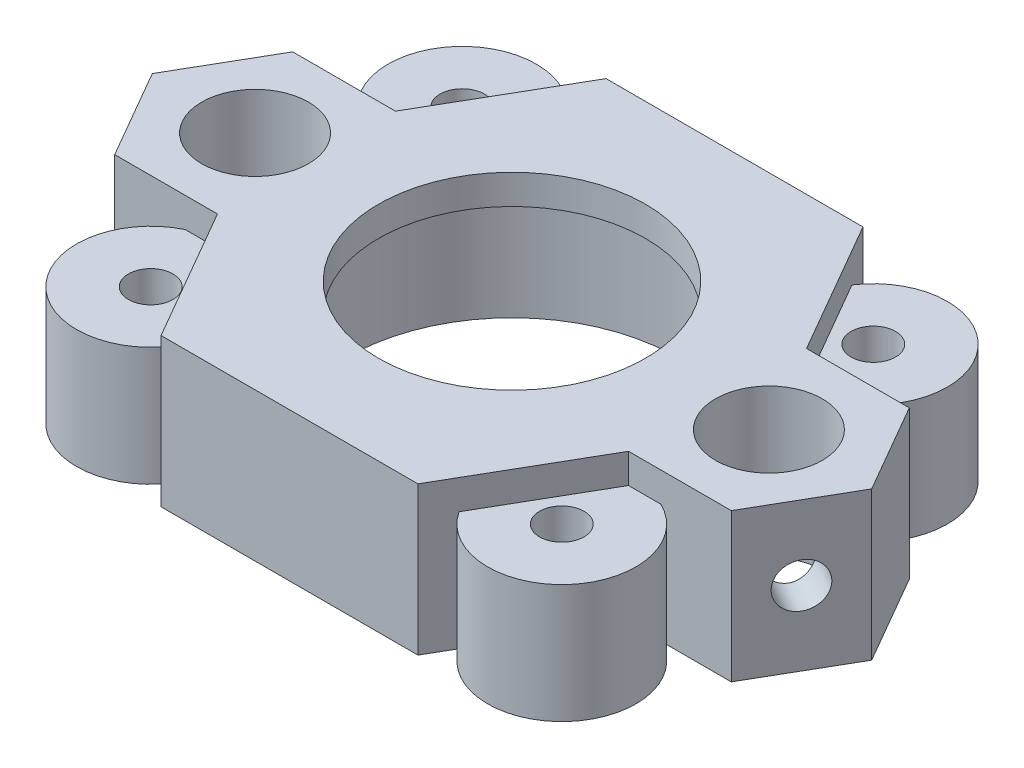
from build123d import *
from build123d.topology import SkipClean

# Parameters (mm, degrees)
SKETCH1_R                      = 1.5
SKETCH1_R_2                    = 3.6
BOSS_EXTRUDE1_DEPTH            = 8
SKETCH2_R                      = 9
SKETCH2_R_2                    = 3.6
BOSS_EXTRUDE2_DEPTH            = 2
CUT_EXTRUDE1_REACH             = 52.762
CUT_EXTRUDE1_END_RADIUS        = 3.6
SKETCH4_R                      = 1.5
CUT_EXTRUDE1_DIRECTION_2_DEPTH = 51.761698159
CUT_EXTRUDE2_REACH             = 52.762
CUT_EXTRUDE2_END_RADIUS        = 3.6
SKETCH5_R                      = 1.5


with BuildPart() as part:
    # Sketch1 → Boss-Extrude1 (new body)
    with BuildSketch(Plane(origin=(0, 0, 0), x_dir=(1, 0, 0), z_dir=(0, 1, 0))):
        with BuildLine():
            Line((9.675277915, 13.241927075), (8.660254038, 15))
            Line((8.660254038, 15), (-8.660254038, 15))
            Line((-8.660254038, 15), (-9.675277915, 13.241927075))
            ThreePointArc((-9.675277915, 13.241927075), (-17.613141308, 13.799536829), (-16.035855932, 6))
            Line((-16.035855932, 6), (-20.784609691, 6))
            Line((-20.784609691, 6), (-24.248711306, 0))
            Line((-24.248711306, 0), (-20.784609691, -6))
            Line((-20.784609691, -6), (-16.035855932, -6))
            ThreePointArc((-16.035855932, -6), (-17.613141308, -13.799536829), (-9.675277915, -13.241927075))
            Line((-9.675277915, -13.241927075), (-8.660254038, -15))
            Line((-8.660254038, -15), (8.660254038, -15))
            Line((8.660254038, -15), (9.675277915, -13.241927075))
            ThreePointArc((9.675277915, -13.241927075), (17.613141308, -13.799536829), (16.035855932, -6))
            Line((16.035855932, -6), (20.784609691, -6))
            Line((20.784609691, -6), (24.248711306, 0))
            Line((24.248711306, 0), (20.784609691, 6))
            Line((20.784609691, 6), (16.035855932, 6))
            ThreePointArc((16.035855932, 6), (17.613141308, 13.799536829), (9.675277915, 13.241927075))
        make_face()
        with Locations((-13.856406461, -10.5)):
            Circle(SKETCH1_R, mode=Mode.SUBTRACT)
        with Locations((13.856406461, -10.5)):
            Circle(SKETCH1_R, mode=Mode.SUBTRACT)
        with BuildLine():
            ThreePointArc((-13.720508076, 0), (-20.438199529, -1.8), (-15.520508076, 3.117691454))
            ThreePointArc((-15.520508076, 3.117691454), (-14.202816622, 1.8), (-13.720508076, 0))
        make_face(mode=Mode.SUBTRACT)
        with Locations((-13.856406461, 10.5)):
            Circle(SKETCH1_R, mode=Mode.SUBTRACT)
        with BuildLine():
            ThreePointArc((11.064000224, 1.163410523), (11.109739589, 0.582504296), (11.125, 0))
            ThreePointArc((11.125, 0), (-11.109739589, -0.582504296), (11.064000224, 1.163410523))
        make_face(mode=Mode.SUBTRACT)
        with Locations((17.320508076, 0)):
            Circle(SKETCH1_R_2, mode=Mode.SUBTRACT)
        with Locations((13.856406461, 10.5)):
            Circle(SKETCH1_R, mode=Mode.SUBTRACT)
    extrude(amount=BOSS_EXTRUDE1_DEPTH)

    # Sketch2 → Boss-Extrude2 (add)
    with SkipClean():  # the faces are left unmerged after this step: merging them gives an invalid solid
        with BuildSketch(Plane(origin=(0, 8, 0), x_dir=(1, 0, 0), z_dir=(0, 1, 0))):
            Polygon((8.660254038, -15), (13.856406461, -6), (20.784609691, -6), (24.248711306, 0), (20.784609691, 6), (13.856406461, 6), (8.660254038, 15), (-8.660254038, 15), (-13.856406461, 6), (-20.784609691, 6), (-24.248711306, 0), (-20.784609691, -6), (-13.856406461, -6), (-8.660254038, -15), align=None)
            Circle(SKETCH2_R, mode=Mode.SUBTRACT)
            with Locations((-17.320508076, 0)):
                Circle(SKETCH2_R_2, mode=Mode.SUBTRACT)
            with Locations((17.320508076, 0)):
                Circle(SKETCH2_R_2, mode=Mode.SUBTRACT)
        extrude(amount=BOSS_EXTRUDE2_DEPTH)

    # Cut-Extrude1: up to this cylinder (the profile starts outside it)
    cut_extrude1_end = Plane(origin=(-17.320508076, 5, 0), z_dir=(0, -1, 0)) * Cylinder(CUT_EXTRUDE1_END_RADIUS, 113.724, mode=Mode.PRIVATE)
    # Sketch4 → Cut-Extrude1 (cut, up to the surface)
    with BuildSketch(Plane(origin=(-18.186533479, 0, 10.5), x_dir=(0.500000000000001, 0, 0.866025403784438), z_dir=(-0.866025403784438, 0, 0.500000000000001)), mode=Mode.PRIVATE) as cut_extrude1_sk1:
        with Locations((-8.660254038, 5)):
            Circle(SKETCH4_R)
    cut_extrude1_tool1 = extrude(cut_extrude1_sk1.sketch, amount=-CUT_EXTRUDE1_REACH, mode=Mode.PRIVATE) - cut_extrude1_end
    add(cut_extrude1_tool1.solids().sort_by_distance((-22.51666, 5, 3))[0], mode=Mode.SUBTRACT)

    # Sketch4 → Cut-Extrude1 direction 2 (cut)
    with BuildSketch(Plane(origin=(-18.186533479, 0, 10.5), x_dir=(0.500000000000001, 0, 0.866025403784438), z_dir=(-0.866025403784438, 0, 0.500000000000001))):
        with Locations((-8.660254038, 5)):
            Circle(SKETCH4_R)
    extrude(amount=CUT_EXTRUDE1_DIRECTION_2_DEPTH, mode=Mode.SUBTRACT)

    # Cut-Extrude2: up to this cylinder (the profile starts outside it)
    cut_extrude2_end = Plane(origin=(17.320508076, 5, 0), z_dir=(0, -1, 0)) * Cylinder(CUT_EXTRUDE2_END_RADIUS, 113.724, mode=Mode.PRIVATE)
    # Sketch5 → Cut-Extrude2 (cut, up to the surface)
    with BuildSketch(Plane(origin=(18.186533479, 0, 10.5), x_dir=(0.5000000000000004, 0, -0.8660254037844384), z_dir=(0.8660254037844384, 0, 0.5000000000000004)), mode=Mode.PRIVATE) as cut_extrude2_sk1:
        with Locations((8.660254038, 5)):
            Circle(SKETCH5_R)
    cut_extrude2_tool1 = extrude(cut_extrude2_sk1.sketch, amount=-CUT_EXTRUDE2_REACH, mode=Mode.PRIVATE) - cut_extrude2_end
    add(cut_extrude2_tool1.solids().sort_by_distance((22.51666, 5, 3))[0], mode=Mode.SUBTRACT)


solid = part.part
